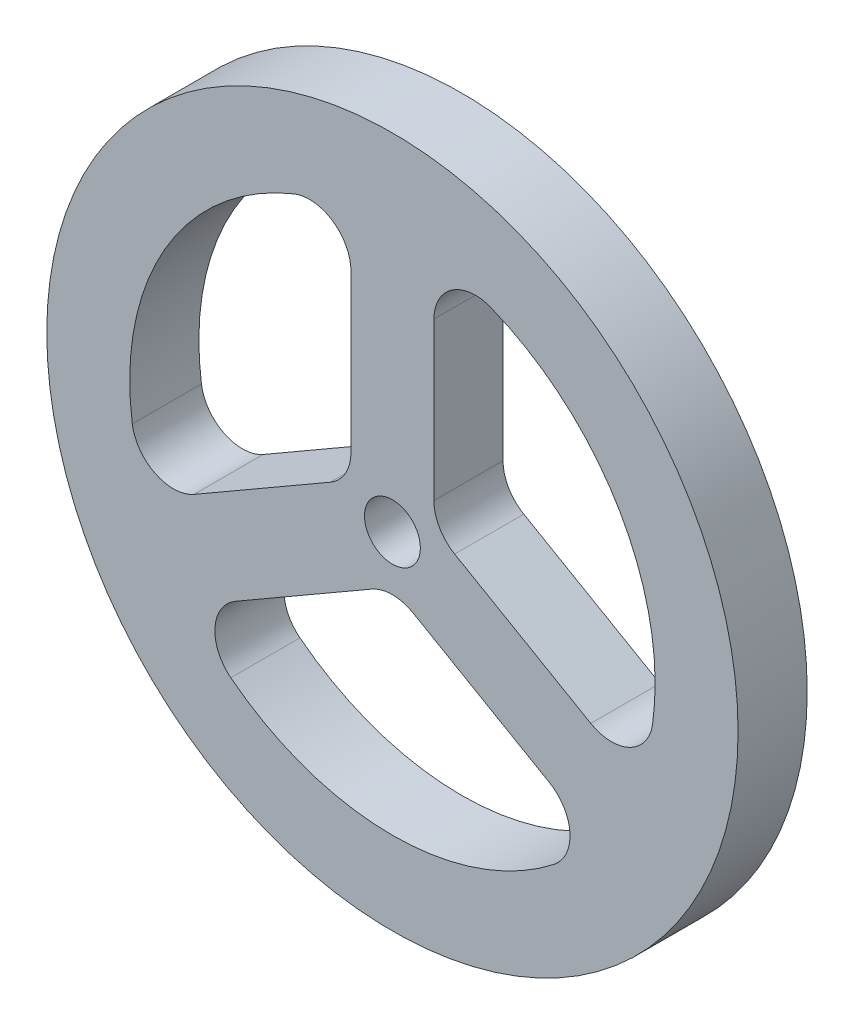
from build123d import *

# Parameters (mm, degrees)
SKETCH1_R           = 31.75
SKETCH1_R_2         = 2.5654
BOSS_EXTRUDE3_DEPTH = 6.35
FILLET1_R           = 3.81


with BuildPart() as part:
    # Sketch1 → Boss-Extrude3 (new body)
    with BuildSketch(Plane.XY):
        Circle(SKETCH1_R)
        with BuildLine():
            Line((-18.730057548, -15.213212818), (0, -4.399409051))
            Line((0, -4.399409051), (18.730057548, -15.213212818))
            ThreePointArc((18.730057548, -15.213212818), (0, -24.13), (-18.730057548, -15.213212818))
        make_face(mode=Mode.SUBTRACT)
        with BuildLine():
            Line((-3.81, 23.82731206), (-3.81, 2.199704526))
            Line((-3.81, 2.199704526), (-22.540057548, -8.614099242))
            ThreePointArc((-22.540057548, -8.614099242), (-20.897192993, 12.065), (-3.81, 23.82731206))
        make_face(mode=Mode.SUBTRACT)
        Circle(SKETCH1_R_2, mode=Mode.SUBTRACT)
        with BuildLine():
            Line((22.540057548, -8.614099242), (3.81, 2.199704526))
            Line((3.81, 2.199704526), (3.81, 23.82731206))
            ThreePointArc((3.81, 23.82731206), (20.897192993, 12.065), (22.540057548, -8.614099242))
        make_face(mode=Mode.SUBTRACT)
    extrude(amount=BOSS_EXTRUDE3_DEPTH)

    # Fillet1
    fillet1_edges = [part.edges().sort_by_distance(p)[0] for p in [
        (0, -4.399409051, 3.175),
        (-18.730057548, -15.213212818, 3.175),
        (3.81, 23.82731206, 3.175),
        (3.81, 2.199704526, 3.175),
        (-22.540057548, -8.614099242, 3.175),
        (-3.81, 2.199704526, 3.175),
        (-3.81, 23.82731206, 3.175),
        (18.730057548, -15.213212818, 3.175),
        (22.540057548, -8.614099242, 3.175),
    ]]
    fillet(fillet1_edges, radius=FILLET1_R)


solid = part.part
